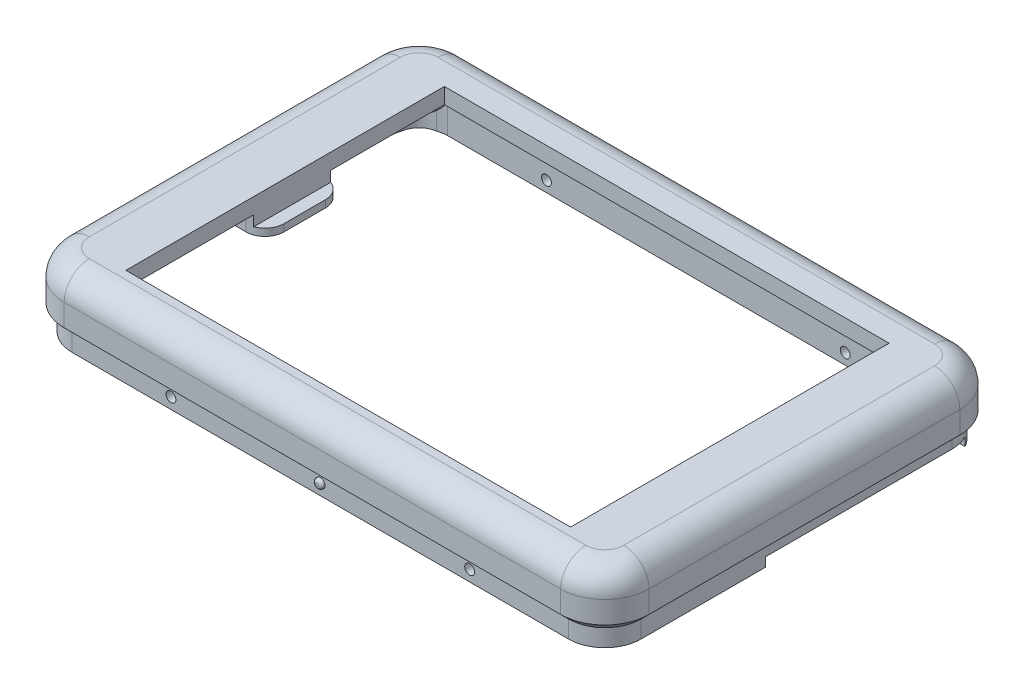
from build123d import *
from build123d.topology import SkipClean

# Parameters (mm, degrees)
BOSS_EXTRUDE1_DEPTH = 4.5
SHELL1_T            = -2.5
SKETCH2_W           = 70.5
SKETCH2_H           = 50.5
CUT_EXTRUDE1_DEPTH  = 6
FILLET1_R           = 2
FILLET2_R           = 4
SKETCH3_R           = 3.25
SKETCH3_R_2         = 1.25
BOSS_EXTRUDE2_DEPTH = 2.5
BOSS_EXTRUDE3_START = 3
BOSS_EXTRUDE3_DEPTH = 3
SKETCH5_W           = 12.567423642
SKETCH5_H           = 1.646842997
BOSS_EXTRUDE4_DEPTH = 4
BOSS_EXTRUDE5_DEPTH = 12.567423642
FILLET4_R           = 3
SKETCH8_W           = 70.5
SKETCH8_H           = 50.5
CUT_EXTRUDE2_DEPTH  = 4
BOSS_EXTRUDE6_START = 4
BOSS_EXTRUDE6_DEPTH = 4
CHAMFER1_SIZE       = 1.25
SKETCH11_W          = 15.487290784
SKETCH11_H          = 50.5
CUT_EXTRUDE3_DEPTH  = 24
CUT_EXTRUDE4_START  = -6.5
SKETCH13_R          = 3.25
CUT_EXTRUDE4_DEPTH  = 6.5
SKETCH14_R          = 0.75
BOSS_EXTRUDE7_DEPTH = 0.5
FILLET5_R           = 0.5
BOSS_EXTRUDE8_START = 0.5
SKETCH15_R          = 0.75
BOSS_EXTRUDE8_DEPTH = 0.5
FILLET6_R           = 0.5
SKETCH16_W          = 32.358974192
SKETCH16_H          = 1.7505668
CUT_EXTRUDE5_DEPTH  = 20.5
SKETCH17_R          = 0.783892082
CUT_EXTRUDE6_DEPTH  = 78.755475834


# Some blends are built 0.0001 mm under size
with BuildPart() as part:
    # Sketch1 → Boss-Extrude1 (new body)
    with BuildSketch(Plane(origin=(0, 0, 0), x_dir=(1, 0, 0), z_dir=(0, 1, 0))):
        with BuildLine():
            Line((46.356686108, -24.641010635), (46.356686108, 24.641010635))
            ThreePointArc((46.356686108, 24.641010635), (44.306433576, 29.590758103), (39.356686108, 31.641010635))
            Line((39.356686108, 31.641010635), (-39.356686108, 31.641010635))
            ThreePointArc((-39.356686108, 31.641010635), (-44.306433576, 29.590758103), (-46.356686108, 24.641010635))
            Line((-46.356686108, 24.641010635), (-46.356686108, -24.641010635))
            ThreePointArc((-46.356686108, -24.641010635), (-44.306433576, -29.590758103), (-39.356686108, -31.641010635))
            Line((-39.356686108, -31.641010635), (39.356686108, -31.641010635))
            ThreePointArc((39.356686108, -31.641010635), (44.306433576, -29.590758103), (46.356686108, -24.641010635))
        make_face()
    extrude(amount=BOSS_EXTRUDE1_DEPTH)

    # Shell1
    shell1_openings = [part.faces().sort_by_distance(p)[0] for p in [
        (0, 0, 0),
    ]]
    offset(amount=SHELL1_T, openings=shell1_openings, kind=Kind.INTERSECTION)

    # Sketch2 → Cut-Extrude1 (cut)
    with BuildSketch(Plane(origin=(0, 4.5, 0), x_dir=(1, 0, 0), z_dir=(0, 1, 0))):
        with Locations((0.393313892, -1.108989365)):
            Rectangle(SKETCH2_W, SKETCH2_H)
    extrude(amount=-CUT_EXTRUDE1_DEPTH, mode=Mode.SUBTRACT)

    # Fillet1
    fillet1_edges = [part.edges().sort_by_distance(p)[0] for p in [
        (42.538666623, 2, 27.82299115),
        (0, 2, 29.141010635),
        (-42.538666623, 2, 27.82299115),
        (-43.856686108, 2, 0),
        (-42.538666623, 2, -27.82299115),
        (0, 2, -29.141010635),
        (42.538666623, 2, -27.82299115),
        (43.856686108, 2, 0),
    ]]
    fillet(fillet1_edges, radius=FILLET1_R - 0.0001)  # a hair under: the kernel refuses the full size

    # Fillet2
    fillet2_edges = [part.edges().sort_by_distance(p)[0] for p in [
        (44.306433576, 4.5, -29.590758103),
        (0, 4.5, -31.641010635),
        (-44.306433576, 4.5, -29.590758103),
        (-46.356686108, 4.5, 0),
        (-44.306433576, 4.5, 29.590758103),
        (0, 4.5, 31.641010635),
        (44.306433576, 4.5, 29.590758103),
        (46.356686108, 4.5, 0),
    ]]
    fillet(fillet2_edges, radius=FILLET2_R)

    # Sketch3 → Boss-Extrude2 (add)
    # profile 1 of 4: a face of its own
    with BuildSketch(Plane.XZ.offset(-2)):
        with Locations(Location((-40.393075335, 23.335972527, 0), (0, 0, 100.663495608))):
            Circle(SKETCH3_R)
        with Locations(Location((-40.393075335, 23.335972527, 0), (0, 0, 270))):
            Circle(SKETCH3_R_2, mode=Mode.SUBTRACT)
    # profile 2 of 4: a face of its own
    with BuildSketch(Plane.XZ.offset(-2)):
        with Locations(Location((-40.393075335, -25.664027473, 0), (0, 0, 116.76561408))):
            Circle(SKETCH3_R)
        with Locations(Location((-40.393075335, -25.664027473, 0), (0, 0, 179.461771678))):
            Circle(SKETCH3_R_2, mode=Mode.SUBTRACT)
    # profile 3 of 4: a face of its own
    with BuildSketch(Plane.XZ.offset(-2)):
        with Locations(Location((37.638494393, -25.664027473, 0), (0, 0, 127.872158601))):
            Circle(SKETCH3_R)
        with Locations(Location((37.638494393, -25.664027473, 0), (0, 0, 270))):
            Circle(SKETCH3_R_2, mode=Mode.SUBTRACT)
    # profile 4 of 4: a face of its own
    with BuildSketch(Plane.XZ.offset(-2)):
        with Locations(Location((37.638494393, 23.335972526, 0), (0, 0, 127.872158601))):
            Circle(SKETCH3_R)
        with Locations(Location((37.638494393, 23.335972526, 0), (0, 0, 270))):
            Circle(SKETCH3_R_2, mode=Mode.SUBTRACT)
    extrude(amount=BOSS_EXTRUDE2_DEPTH)

    # Sketch4 → Boss-Extrude3 (add)
    with SkipClean():  # the faces are left unmerged after this step: merging them gives an invalid solid
        with BuildSketch(Plane.XZ.offset(BOSS_EXTRUDE3_START)):
            with BuildLine():
                Line((39.356686108, 31.641010635), (-39.356686108, 31.641010635))
                ThreePointArc((-39.356686108, 31.641010635), (-44.306433576, 29.590758103), (-46.356686108, 24.641010635))
                Line((-46.356686108, 24.641010635), (-46.356686108, -24.641010635))
                ThreePointArc((-46.356686108, -24.641010635), (-44.306433576, -29.590758103), (-39.356686108, -31.641010635))
                Line((-39.356686108, -31.641010635), (39.356686108, -31.641010635))
                ThreePointArc((39.356686108, -31.641010635), (44.306433576, -29.590758103), (46.356686108, -24.641010635))
                Line((46.356686108, -24.641010635), (46.356686108, 24.641010635))
                ThreePointArc((46.356686108, 24.641010635), (44.306433576, 29.590758103), (39.356686108, 31.641010635))
            make_face()
            with BuildLine():
                Line((39.356686108, 29.141010635), (-39.356686108, 29.141010635))
                ThreePointArc((-39.356686108, 29.141010635), (-42.538666623, 27.82299115), (-43.856686108, 24.641010635))
                Line((-43.856686108, 24.641010635), (-43.856686108, -24.641010635))
                ThreePointArc((-43.856686108, -24.641010635), (-42.538666623, -27.82299115), (-39.356686108, -29.141010635))
                Line((-39.356686108, -29.141010635), (39.356686108, -29.141010635))
                ThreePointArc((39.356686108, -29.141010635), (42.538666623, -27.82299115), (43.856686108, -24.641010635))
                Line((43.856686108, -24.641010635), (43.856686108, 24.641010635))
                ThreePointArc((43.856686108, 24.641010635), (42.538666623, 27.82299115), (39.356686108, 29.141010635))
            make_face(mode=Mode.SUBTRACT)
        extrude(amount=-BOSS_EXTRUDE3_DEPTH)

    # Sketch5 → Boss-Extrude4 (add)
    with SkipClean():  # the faces are left unmerged after this step: merging them gives an invalid solid
        with BuildSketch(Plane(origin=(-34.856686108, 0, 0), x_dir=(0, 0, -1), z_dir=(1, 0, 0))):
            with Locations((0.008961538, 1.176578502)):
                Rectangle(SKETCH5_W, SKETCH5_H)
        extrude(amount=-BOSS_EXTRUDE4_DEPTH)

    # Sketch6 → Boss-Extrude5 (add)
    with SkipClean():  # the faces are left unmerged after this step: merging them gives an invalid solid
        with BuildSketch(Plane.XY.offset(6.274750283)):
            Polygon((-34.856686108, 0.353157003), (-32.884887287, 0.353157003), (-32.884887287, -0.785578936), (-38.308352122, -0.785578936), (-38.856686108, 0.353157003), align=None)
        extrude(amount=-BOSS_EXTRUDE5_DEPTH)

    # Fillet4
    # the kernel refuses this fillet: 3 mm, written as the material it takes off along each edge
    with BuildSketch(Plane(origin=(-32.884887287, 7.853157003, -6.292673359), x_dir=(-1, 0, 0), z_dir=(0, -1, 0))) as fillet4_piece_1_section:
        with BuildLine():
            CenterArc((FILLET4_R, -FILLET4_R), FILLET4_R, 90, 90)
            Line((0, -FILLET4_R), (0, 0))
            Line((0, 0), (FILLET4_R, 0))
        make_face()
    fillet4_piece_1 = extrude(amount=16.138735939, mode=Mode.PRIVATE)
    fillet4_piece_1 = split(fillet4_piece_1, bisect_by=Plane(origin=(-35.112153747, 2, -6.238457851), z_dir=(0, -1, 0)), keep=Keep.TOP, mode=Mode.PRIVATE)
    add(fillet4_piece_1, mode=Mode.SUBTRACT)
    with BuildSketch(Plane(origin=(-32.884887287, 7.853157003, 6.274750283), x_dir=(-1, 0, 0), z_dir=(0, -1, 0))) as fillet4_piece_2_section:
        with BuildLine():
            CenterArc((FILLET4_R, FILLET4_R), FILLET4_R, 180, 90)
            Line((0, FILLET4_R), (0, 0))
            Line((0, 0), (FILLET4_R, 0))
        make_face()
    fillet4_piece_2 = extrude(amount=16.138735939, mode=Mode.PRIVATE)
    fillet4_piece_2 = split(fillet4_piece_2, bisect_by=Plane(origin=(-35.112153747, 2, 6.220534774), z_dir=(0, -1, 0)), keep=Keep.TOP, mode=Mode.PRIVATE)
    add(fillet4_piece_2, mode=Mode.SUBTRACT)

    # Sketch8 → Cut-Extrude2 (cut)
    with BuildSketch(Plane(origin=(0, 4.5, 0), x_dir=(1, 0, 0), z_dir=(0, 1, 0))):
        with Locations((0.393313892, -1.108989365)):
            Rectangle(SKETCH8_W, SKETCH8_H)
    extrude(amount=-CUT_EXTRUDE2_DEPTH, mode=Mode.SUBTRACT)

    # Sketch10 → Boss-Extrude6 (add)
    with BuildSketch(Plane.XZ.offset(3).offset(BOSS_EXTRUDE6_START)):
        with BuildLine():
            Line((-39.356686108, -30.391010635), (39.356686108, -30.391010635))
            ThreePointArc((39.356686108, -30.391010635), (43.4225501, -28.706874627), (45.106686108, -24.641010635))
            Line((45.106686108, -24.641010635), (45.106686108, 24.641010635))
            ThreePointArc((45.106686108, 24.641010635), (43.4225501, 28.706874627), (39.356686108, 30.391010635))
            Line((39.356686108, 30.391010635), (-39.356686108, 30.391010635))
            ThreePointArc((-39.356686108, 30.391010635), (-43.4225501, 28.706874627), (-45.106686108, 24.641010635))
            Line((-45.106686108, 24.641010635), (-45.106686108, -24.641010635))
            ThreePointArc((-45.106686108, -24.641010635), (-43.4225501, -28.706874627), (-39.356686108, -30.391010635))
        make_face()
        with BuildLine():
            Line((-39.356686108, -29.141010635), (39.356686108, -29.141010635))
            ThreePointArc((39.356686108, -29.141010635), (42.538666623, -27.82299115), (43.856686108, -24.641010635))
            Line((43.856686108, -24.641010635), (43.856686108, 24.641010635))
            ThreePointArc((43.856686108, 24.641010635), (42.538666623, 27.82299115), (39.356686108, 29.141010635))
            Line((39.356686108, 29.141010635), (-39.356686108, 29.141010635))
            ThreePointArc((-39.356686108, 29.141010635), (-42.538666623, 27.82299115), (-43.856686108, 24.641010635))
            Line((-43.856686108, 24.641010635), (-43.856686108, -24.641010635))
            ThreePointArc((-43.856686108, -24.641010635), (-42.538666623, -27.82299115), (-39.356686108, -29.141010635))
        make_face(mode=Mode.SUBTRACT)
    extrude(amount=-BOSS_EXTRUDE6_DEPTH)

    # Chamfer1
    chamfer1_edges = [part.edges().sort_by_distance(p)[0] for p in [
        (-43.4225501, -3, -28.706874627),
        (0, -3, -30.391010635),
        (43.4225501, -3, -28.706874627),
        (45.106686108, -3, 0),
        (43.4225501, -3, 28.706874627),
        (0, -3, 30.391010635),
        (-43.4225501, -3, 28.706874627),
        (-45.106686108, -3, 0),
    ]]
    chamfer(chamfer1_edges, length=CHAMFER1_SIZE - 0.0001)  # a hair under: the kernel refuses the full size

    # Sketch11 → Cut-Extrude3 (cut)
    with BuildSketch(Plane(origin=(0, 4.5, 0), x_dir=(1, 0, 0), z_dir=(0, 1, 0))):
        with Locations((27.8996685, -1.108989365)):
            Rectangle(SKETCH11_W, SKETCH11_H)
    extrude(amount=-CUT_EXTRUDE3_DEPTH, mode=Mode.SUBTRACT)

    # Sketch13 → Cut-Extrude4 (cut)
    with BuildSketch(Plane.XZ.offset(7).offset(CUT_EXTRUDE4_START)):
        with Locations((-40.393075335, -25.664027473)):
            Circle(SKETCH13_R)
    extrude(amount=CUT_EXTRUDE4_DEPTH, mode=Mode.SUBTRACT)

    # Sketch14 → Boss-Extrude7 (add)
    with BuildSketch(Plane(origin=(0, 0, -30.391010635), x_dir=(-1, 0, 0), z_dir=(0, 0, -1))):
        with Locations(Location((0, -5.25, 0), (0, 0, 180))):
            Circle(SKETCH14_R)
    extrude(amount=BOSS_EXTRUDE7_DEPTH)

    # Fillet5
    fillet5_edges = [part.edges().sort_by_distance(p)[0] for p in [
        (-0.75, -5.25, -30.891010635),
    ]]
    fillet(fillet5_edges, radius=FILLET5_R - 0.0001)  # a hair under: the kernel refuses the full size

    # Sketch15 → Boss-Extrude8 (add)
    with BuildSketch(Plane.XY.offset(30.391010635).offset(BOSS_EXTRUDE8_START)):
        with Locations(Location((0, -5.25, 0), (0, 0, 180))):
            Circle(SKETCH15_R)
    extrude(amount=-BOSS_EXTRUDE8_DEPTH)

    # Fillet6
    fillet6_edges = [part.edges().sort_by_distance(p)[0] for p in [
        (0.75, -5.25, 30.891010635),
    ]]
    fillet(fillet6_edges, radius=FILLET6_R - 0.0001)  # a hair under: the kernel refuses the full size

    # Sketch16 → Cut-Extrude5 (cut)
    with BuildSketch(Plane(origin=(45.106686108, 0, 0), x_dir=(0, 0, -1), z_dir=(1, 0, 0))):
        with Locations((11.286987709, -6.446354596)):
            Rectangle(SKETCH16_W, SKETCH16_H)
    extrude(amount=-CUT_EXTRUDE5_DEPTH, mode=Mode.SUBTRACT)

    # Sketch17 → Cut-Extrude6 (cut, through all)
    with BuildSketch(Plane(origin=(0, 0, -30.391010635), x_dir=(-1, 0, 0), z_dir=(0, 0, -1))):
        with Locations((23.679650241, -5.268916998)):
            Circle(SKETCH17_R)
        with Locations((-23.679650241, -5.268916998)):
            Circle(SKETCH17_R)
    extrude(amount=-CUT_EXTRUDE6_DEPTH, mode=Mode.SUBTRACT)


solid = part.part
